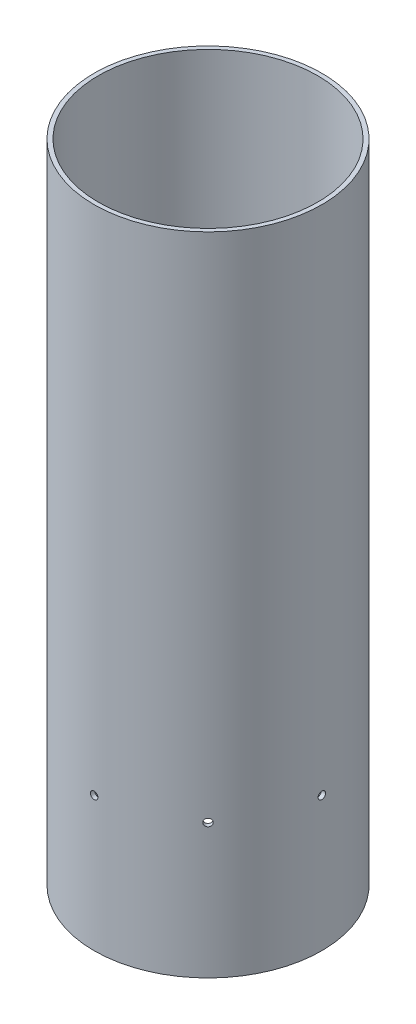
from build123d import *

# Parameters (mm, degrees)
SKETCH1_R            = 53.721
SKETCH1_R_2          = 51.7271
BOSS_EXTRUDE1_DEPTH  = 304.8
SKETCH2_R            = 1.7526
BULKHEAD_HOLES_DEPTH = 127
CIRPATTERN1_COUNT    = 8


with BuildPart() as part:
    # Sketch1 → Boss-Extrude1 (new body)
    with BuildSketch(Plane(origin=(0, 0, 0), x_dir=(1, 0, 0), z_dir=(0, 1, 0))):
        Circle(SKETCH1_R)
        Circle(SKETCH1_R_2, mode=Mode.SUBTRACT)
    extrude(amount=BOSS_EXTRUDE1_DEPTH)

    # Sketch2 → Bulkhead Holes (cut)
    with BuildSketch(Plane.XY):
        with Locations((0, 63.5)):
            Circle(SKETCH2_R)
    bulkhead_holes = extrude(amount=-BULKHEAD_HOLES_DEPTH, mode=Mode.SUBTRACT)

    # CirPattern1: Bulkhead Holes ×8 about axis
    cirpattern1_axis = Axis((0, 304.8, 0), (0, -1, 0))
    for i in range(1, CIRPATTERN1_COUNT):
        add(bulkhead_holes.rotate(cirpattern1_axis, i * 360 / CIRPATTERN1_COUNT), mode=Mode.SUBTRACT)


solid = part.part
